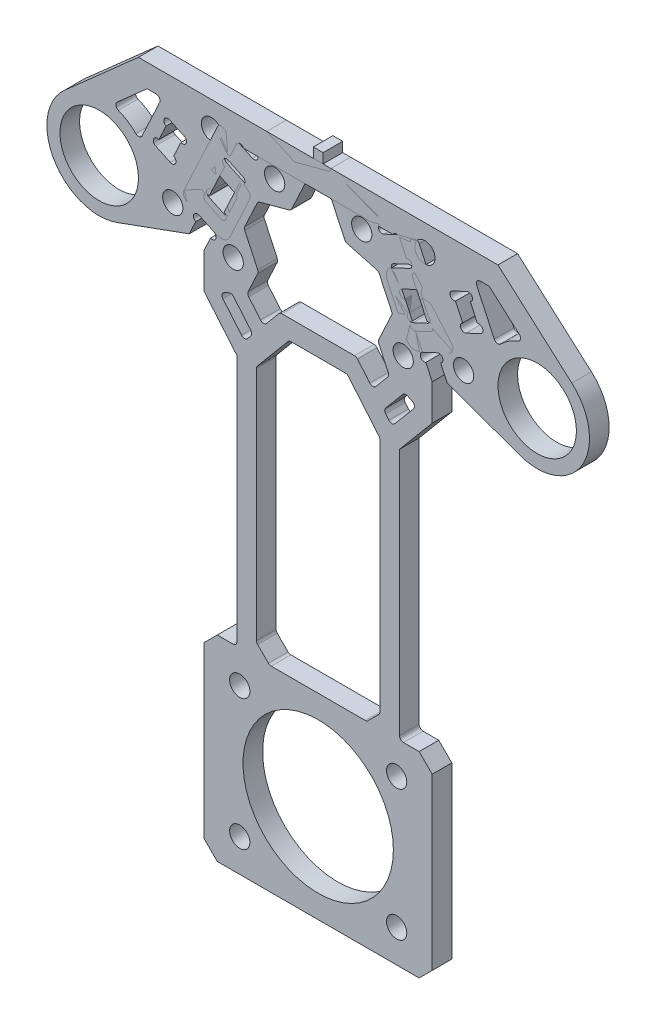
from build123d import *

# Parameters (mm, degrees)
F_3MM_START         = -1.5
F_3MM_OUTLINE_R     = 6
F_3MM_OUTLINE_R_2   = 1.55
F_3MM_DEPTH         = 3
SKETCH_2_R          = 11.5
EXTRUDE_1_DEPTH     = 1.5
EXTRUDE_2_DEPTH     = 3
SKETCH_4_R          = 0.6
CUT_EXTRUDE_1_DEPTH = 95.188640504
FILLET_1_R          = 1
SKETCH_5_R          = 1.55
CUT_EXTRUDE_2_DEPTH = 95.188640504
EXTRUDE_3_DEPTH     = 3
SKETCH_7_R          = 1.55
CUT_EXTRUDE_3_DEPTH = 95.188640504
CUT_EXTRUDE_4_DEPTH = 95.188640504
CHAMFER_1_SIZE      = 2
CUT_EXTRUDE_5_DEPTH = 95.188640504
FILLET_2_R          = 0.6


# Read off the part's stored shape, not the designer's step: 弹轮后支撑-轨道连接板_3mm
with BuildPart() as part:
    # 弹轮后支撑-轨道连接板_3mm outline → 弹轮后支撑-轨道连接板_3mm (new body)
    with BuildSketch(Plane.XY.offset(F_3MM_START)):
        with BuildLine():
            Line((-1.95, 16), (-27.5, 16))
            Line((-27.5, 16), (-38.803964436, 5.988986664))
            ThreePointArc((-38.803964436, 5.988986664), (-40.374225454, -4.092068476), (-30.763838853, -7.517540966))
            Line((-30.763838853, -7.517540966), (-19.728184266, -3.500891181))
            Line((-19.728184266, -3.500891181), (-18.734325356, -1.36955387))
            ThreePointArc((-18.734325356, -1.36955387), (-19.024539071, -0.572198241), (-18.227183442, -0.281984526))
            Line((-18.227183442, -0.281984526), (-15.508260081, -1.549839311))
            ThreePointArc((-15.508260081, -1.549839311), (-14.361302473, -1.599916561), (-13.514871007, -0.824305023))
            Line((-13.514871007, -0.824305023), (-10.556543175, 5.519849486))
            ThreePointArc((-10.556543175, 5.519849486), (-10.506465925, 6.666807094), (-11.282077463, 7.51323856))
            Line((-11.282077463, 7.51323856), (-14.001000824, 8.781093345))
            ThreePointArc((-14.001000824, 8.781093345), (-14.291214539, 9.578448974), (-13.49385891, 9.868662689))
            Line((-13.49385891, 9.868662689), (-12.5, 12))
            ThreePointArc((-12.5, 12), (-11.956215328, 12.346429043), (-11.412430656, 12))
            Line((-11.412430656, 12), (11.412430656, 12))
            ThreePointArc((11.412430656, 12), (11.956215328, 12.346429043), (12.5, 12))
            Line((12.5, 12), (13.49385891, 9.868662689))
            ThreePointArc((13.49385891, 9.868662689), (14.291214539, 9.578448974), (14.001000824, 8.781093345))
            Line((14.001000824, 8.781093345), (11.282077463, 7.51323856))
            ThreePointArc((11.282077463, 7.51323856), (10.506465925, 6.666807094), (10.556543175, 5.519849486))
            Line((10.556543175, 5.519849486), (13.514871007, -0.824305023))
            ThreePointArc((13.514871007, -0.824305023), (14.361302473, -1.599916561), (15.508260081, -1.549839311))
            Line((15.508260081, -1.549839311), (18.227183442, -0.281984526))
            ThreePointArc((18.227183442, -0.281984526), (19.024539071, -0.572198241), (18.734325356, -1.36955387))
            Line((18.734325356, -1.36955387), (19.728184266, -3.500891181))
            Line((19.728184266, -3.500891181), (30.763838853, -7.517540966))
            ThreePointArc((30.763838853, -7.517540966), (40.374225454, -4.092068476), (38.803964436, 5.988986664))
            Line((38.803964436, 5.988986664), (27.5, 16))
            Line((27.5, 16), (1.95, 16))
            ThreePointArc((1.95, 16), (1.35, 15.4), (0.75, 16))
            Line((0.75, 16), (0.75, 17.5))
            Line((0.75, 17.5), (-0.75, 17.5))
            Line((-0.75, 17.5), (-0.75, 16))
            ThreePointArc((-0.75, 16), (-1.35, 15.4), (-1.95, 16))
        make_face()
        with Locations((-33.5, 0)):
            Circle(F_3MM_OUTLINE_R, mode=Mode.SUBTRACT)
        with Locations((-22.24449722, -0.615436184)):
            Circle(F_3MM_OUTLINE_R_2, mode=Mode.SUBTRACT)
        with BuildLine():
            Line((-16.663495873, 3.071354286), (-15.564688393, 5.427754533))
            ThreePointArc((-15.564688393, 5.427754533), (-15.854902108, 6.225110162), (-15.057546479, 6.515323877))
            Line((-15.057546479, 6.515323877), (-12.791777011, 5.458778223))
            ThreePointArc((-12.791777011, 5.458778223), (-12.501563296, 4.661422594), (-13.298918925, 4.371208878))
            Line((-13.298918925, 4.371208878), (-14.397726406, 2.014808632))
            ThreePointArc((-14.397726406, 2.014808632), (-14.10751269, 1.217453003), (-14.90486832, 0.927239288))
            Line((-14.90486832, 0.927239288), (-17.170637787, 1.983784942))
            ThreePointArc((-17.170637787, 1.983784942), (-17.460851502, 2.781140571), (-16.663495873, 3.071354286))
        make_face(mode=Mode.SUBTRACT)
        with BuildLine():
            Line((15.564688393, 5.427754533), (16.663495873, 3.071354286))
            ThreePointArc((16.663495873, 3.071354286), (17.460851502, 2.781140571), (17.170637787, 1.983784942))
            Line((17.170637787, 1.983784942), (14.90486832, 0.927239288))
            ThreePointArc((14.90486832, 0.927239288), (14.10751269, 1.217453003), (14.397726406, 2.014808632))
            Line((14.397726406, 2.014808632), (13.298918925, 4.371208878))
            ThreePointArc((13.298918925, 4.371208878), (12.501563296, 4.661422594), (12.791777011, 5.458778223))
            Line((12.791777011, 5.458778223), (15.057546479, 6.515323877))
            ThreePointArc((15.057546479, 6.515323877), (15.854902108, 6.225110162), (15.564688393, 5.427754533))
        make_face(mode=Mode.SUBTRACT)
        with Locations((22.24449722, -0.615436184)):
            Circle(F_3MM_OUTLINE_R_2, mode=Mode.SUBTRACT)
        with Locations((33.5, 0)):
            Circle(F_3MM_OUTLINE_R, mode=Mode.SUBTRACT)
        with BuildLine():
            ThreePointArc((-22.101342595, 5.607063857), (-21.81112888, 4.809708228), (-22.608484509, 4.519494512))
            Line((-22.608484509, 4.519494512), (-24.874253977, 5.576040167))
            ThreePointArc((-24.874253977, 5.576040167), (-25.164467692, 6.373395796), (-24.367112063, 6.663609511))
            Line((-24.367112063, 6.663609511), (-23.268304582, 9.020009758))
            ThreePointArc((-23.268304582, 9.020009758), (-23.558518298, 9.817365387), (-22.761162668, 10.107579102))
            Line((-22.761162668, 10.107579102), (-20.495393201, 9.051033448))
            ThreePointArc((-20.495393201, 9.051033448), (-20.205179486, 8.253677819), (-21.002535115, 7.963464103))
            Line((-21.002535115, 7.963464103), (-22.101342595, 5.607063857))
        make_face(mode=Mode.SUBTRACT)
        with BuildLine():
            Line((-25.945473235, 12.5), (-24.794125666, 12.5))
            ThreePointArc((-24.794125666, 12.5), (-24.288090799, 12.222379765), (-24.250340994, 11.646429043))
            Line((-24.250340994, 11.646429043), (-26.93573384, 5.887585502))
            ThreePointArc((-26.93573384, 5.887585502), (-27.372399442, 5.550795971), (-27.899552104, 5.712703682))
            ThreePointArc((-27.899552104, 5.712703682), (-29.146691402, 6.711833152), (-30.567528811, 7.443158787))
            ThreePointArc((-30.567528811, 7.443158787), (-30.938455214, 7.897076945), (-30.745390805, 8.450569696))
            Line((-30.745390805, 8.450569696), (-26.343270567, 12.349174))
            ThreePointArc((-26.343270567, 12.349174), (-26.158188537, 12.461027807), (-25.945473235, 12.5))
        make_face(mode=Mode.SUBTRACT)
        with Locations((-16.327841555, 12.072872835)):
            Circle(F_3MM_OUTLINE_R_2, mode=Mode.SUBTRACT)
        with BuildLine():
            ThreePointArc((22.608484509, 4.519494512), (21.81112888, 4.809708228), (22.101342595, 5.607063857))
            Line((22.101342595, 5.607063857), (21.002535115, 7.963464103))
            ThreePointArc((21.002535115, 7.963464103), (20.205179486, 8.253677819), (20.495393201, 9.051033448))
            Line((20.495393201, 9.051033448), (22.761162668, 10.107579102))
            ThreePointArc((22.761162668, 10.107579102), (23.558518298, 9.817365387), (23.268304582, 9.020009758))
            Line((23.268304582, 9.020009758), (24.367112063, 6.663609511))
            ThreePointArc((24.367112063, 6.663609511), (25.164467692, 6.373395796), (24.874253977, 5.576040167))
            Line((24.874253977, 5.576040167), (22.608484509, 4.519494512))
        make_face(mode=Mode.SUBTRACT)
        with BuildLine():
            Line((26.343270567, 12.349174), (30.745390805, 8.450569696))
            ThreePointArc((30.745390805, 8.450569696), (30.938455214, 7.897076945), (30.567528811, 7.443158787))
            ThreePointArc((30.567528811, 7.443158787), (29.146691402, 6.711833152), (27.899552104, 5.712703682))
            ThreePointArc((27.899552104, 5.712703682), (27.372399442, 5.550795971), (26.93573384, 5.887585502))
            Line((26.93573384, 5.887585502), (24.250340994, 11.646429043))
            ThreePointArc((24.250340994, 11.646429043), (24.288090799, 12.222379765), (24.794125666, 12.5))
            Line((24.794125666, 12.5), (25.945473235, 12.5))
            ThreePointArc((25.945473235, 12.5), (26.158188537, 12.461027807), (26.343270567, 12.349174))
        make_face(mode=Mode.SUBTRACT)
        with Locations((16.327841555, 12.072872835)):
            Circle(F_3MM_OUTLINE_R_2, mode=Mode.SUBTRACT)
    extrude(amount=F_3MM_DEPTH)


with BuildPart() as body_2:
    # 草图2 → 凸台-拉伸1 (new, symmetric)
    with BuildSketch(Plane.XY):
        Polygon((-8.565594394, 14.521856093), (-17.44057789, -4.510607435), (-17.44057789, -84.5), (17.44057789, -84.5), (17.44057789, -4.510607435), (8.565594394, 14.521856093), align=None)
        with Locations((0, -69.5)):
            Circle(SKETCH_2_R, mode=Mode.SUBTRACT)
    extrude(amount=EXTRUDE_1_DEPTH, both=True)

    # 草图3 → 凸台-拉伸2 (add)
    with BuildSketch(Plane.XY.offset(1.5)):
        Polygon((-10.04475831, 11.349778839), (-15.029451138, 13.674179278), (-20.946106803, 0.98587026), (-15.961413974, -1.33853018), (-14.482250058, 1.833547075), (-16.748019526, 2.890092729), (-13.789691693, 9.234247238), (-11.523922226, 8.177701584), align=None)
        Polygon((15.029451138, 13.674179278), (20.946106803, 0.98587026), (15.961413974, -1.33853018), (14.482250058, 1.833547075), (16.748019526, 2.890092729), (13.789691693, 9.234247238), (11.523922226, 8.177701584), (10.04475831, 11.349778839), align=None)
    extrude(amount=-EXTRUDE_2_DEPTH)

    # 草图4 → 切除-拉伸1 (cut, through all)
    with BuildSketch(Plane.XY.offset(1.5)):
        with Locations((-16.494448568, 3.433877401)):
            Circle(SKETCH_4_R)
        with Locations((-14.04326265, 8.690462566)):
            Circle(SKETCH_4_R)
        with Locations((-11.777493183, 7.633916912)):
            Circle(SKETCH_4_R)
        with Locations((-14.228679101, 2.377331747)):
            Circle(SKETCH_4_R)
        with Locations((14.228679101, 2.377331747)):
            Circle(SKETCH_4_R)
        with Locations((11.777493183, 7.633916912)):
            Circle(SKETCH_4_R)
        with Locations((14.04326265, 8.690462566)):
            Circle(SKETCH_4_R)
        with Locations((16.494448568, 3.433877401)):
            Circle(SKETCH_4_R)
        with Locations((-9.791187353, 11.893563511)):
            Circle(SKETCH_4_R)
        with Locations((-16.214984931, -1.882314852)):
            Circle(SKETCH_4_R)
        with Locations((16.214984931, -1.882314852)):
            Circle(SKETCH_4_R)
        with Locations((9.791187353, 11.893563511)):
            Circle(SKETCH_4_R)
    extrude(amount=-CUT_EXTRUDE_1_DEPTH, mode=Mode.SUBTRACT)

    # 圆角1
    fillet_1_edges = [body_2.edges().sort_by_distance(p)[0] for p in [
        (-20.946106803, 0.98587026, 0),
        (-15.029451138, 13.674179278, 0),
        (15.029451138, 13.674179278, 0),
        (20.946106803, 0.98587026, 0),
    ]]
    fillet(fillet_1_edges, radius=FILLET_1_R)

    # 草图5 → 切除-拉伸2 (cut, through all)
    with BuildSketch(Plane.XY.offset(1.5)):
        with Locations((-6.661371924, 10.323768816)):
            Circle(SKETCH_5_R)
        with Locations((-13.00064585, -3.27084799)):
            Circle(SKETCH_5_R)
    cut_extrude_2 = extrude(amount=-CUT_EXTRUDE_2_DEPTH, mode=Mode.SUBTRACT)

    # 镜向1: 切除-拉伸2 across plane
    add(cut_extrude_2.mirror(Plane(origin=(0, 0, 0), x_dir=(0, 0, 1), z_dir=(1, 0, 0))), mode=Mode.SUBTRACT)

    # 草图6 → 凸台-拉伸3 (add)
    with BuildSketch(Plane.XY.offset(1.5)):
        Polygon((-8.565594394, 14.521856093), (-7.87632457, 16), (7.87632457, 16), (8.565594394, 14.521856093), align=None)
    extrude(amount=-EXTRUDE_3_DEPTH)

    # 草图7 → 切除-拉伸3 (cut, through all)
    with BuildSketch(Plane.XY.offset(1.5)):
        with Locations((-12, -59.5)):
            Circle(SKETCH_7_R)
        with Locations((12, -59.5)):
            Circle(SKETCH_7_R)
        with Locations((-12, -79.5)):
            Circle(SKETCH_7_R)
        with Locations((12, -79.5)):
            Circle(SKETCH_7_R)
        Polygon((-17.44057789, -10), (-12.44057789, -15.958767963), (-12.44057789, -54.5), (-17.44057789, -54.5), align=None)
        Polygon((12.44057789, -54.5), (17.44057789, -54.5), (17.44057789, -10), (12.44057789, -15.958767963), align=None)
        Polygon((-4.44057789, -10), (-9.44057789, -15.958767963), (-9.44057789, -54.5), (9.44057789, -54.5), (9.44057789, -15.958767963), (4.44057789, -10), align=None)
    extrude(amount=-CUT_EXTRUDE_3_DEPTH, mode=Mode.SUBTRACT)

    # 草图8 → 切除-拉伸4 (cut, through all)
    with BuildSketch(Plane.XY.offset(1.5)):
        Polygon((-9.22274659, 6.013983911), (-11.345578972, 1.461555177), (-9.138823134, -3.27084799), (-10.877755275, -7), (-8.35862807, -10.002178897), (-5.839500865, -7), (5.839500865, -7), (8.35862807, -10.002178897), (10.877755275, -7), (9.138823134, -3.27084799), (11.345578972, 1.461555177), (9.22274659, 6.013983911), (4.179040131, 7.365440984), (1.551602112, 13), (-1.551602112, 13), (-4.179040131, 7.365440984), align=None)
    extrude(amount=-CUT_EXTRUDE_4_DEPTH, mode=Mode.SUBTRACT)

    # 倒角1
    chamfer_1_edges = [body_2.edges().sort_by_distance(p)[0] for p in [
        (17.44057789, -84.5, 0),
        (-17.44057789, -84.5, 0),
        (9.44057789, -54.5, 0),
        (-9.44057789, -54.5, 0),
        (17.44057789, -54.5, 0),
        (-17.44057789, -54.5, 0),
    ]]
    chamfer(chamfer_1_edges, length=CHAMFER_1_SIZE)

    # 草图9 → 切除-拉伸5 (cut, through all)
    with BuildSketch(Plane.XY.offset(1.5)):
        Polygon((-15.081810865, -8.921759509), (-11.266929712, -13.468157828), (-9.990387181, -11.94683368), (-13.2365223, -8.078240491), align=None)
        Polygon((9.990387181, -11.94683368), (13.2365223, -8.078240491), (15.081810865, -8.921759509), (11.266929712, -13.468157828), align=None)
    extrude(amount=-CUT_EXTRUDE_5_DEPTH, mode=Mode.SUBTRACT)

    # 圆角2
    fillet_2_edges = [body_2.edges().sort_by_distance(p)[0] for p in [
        (-4.44057789, -10, 0),
        (4.44057789, -10, 0),
        (9.44057789, -15.958767963, 0),
        (-9.44057789, -15.958767963, 0),
        (12.44057789, -54.5, 0),
        (-12.44057789, -54.5, 0),
        (-9.22274659, 6.013983911, 0),
        (-4.179040131, 7.365440984, 0),
        (-1.551602112, 13, 0),
        (1.551602112, 13, 0),
        (4.179040131, 7.365440984, 0),
        (9.22274659, 6.013983911, 0),
        (11.345578972, 1.461555177, 0),
        (9.138823134, -3.27084799, 0),
        (10.877755275, -7, 0),
        (8.35862807, -10.002178897, 0),
        (5.839500865, -7, 0),
        (-5.839500865, -7, 0),
        (-8.35862807, -10.002178897, 0),
        (-10.877755275, -7, 0),
        (-9.138823134, -3.27084799, 0),
        (-11.345578972, 1.461555177, 0),
        (7.44057789, -54.5, 0),
        (-7.44057789, -54.5, 0),
        (-9.44057789, -52.5, 0),
        (9.44057789, -52.5, 0),
        (-15.081810865, -8.921759509, 0),
        (-13.2365223, -8.078240491, 0),
        (-9.990387181, -11.94683368, 0),
        (-11.266929712, -13.468157828, 0),
        (11.266929712, -13.468157828, 0),
        (9.990387181, -11.94683368, 0),
        (13.2365223, -8.078240491, 0),
        (15.081810865, -8.921759509, 0),
    ]]
    fillet(fillet_2_edges, radius=FILLET_2_R)


solid = Compound([part.part, body_2.part])
